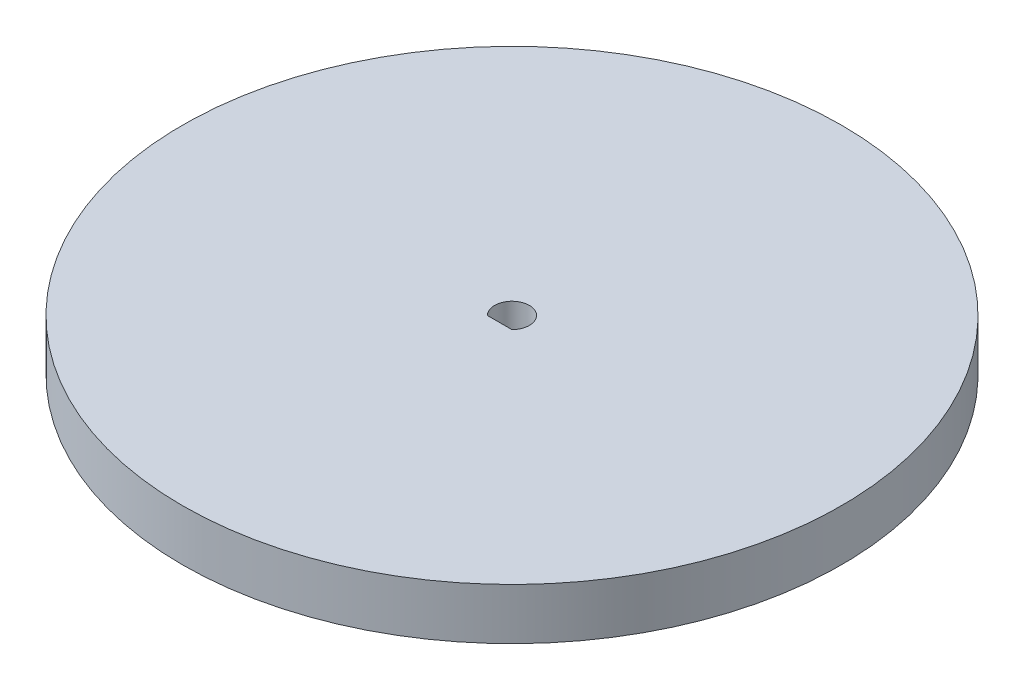
from build123d import *

# Parameters (mm, degrees)
SKETCH1_R           = 45
BOSS_EXTRUDE1_DEPTH = 7


with BuildPart() as part:
    # Sketch1 → Boss-Extrude1 (new body)
    with BuildSketch(Plane(origin=(0, 0, 0), x_dir=(1, 0, 0), z_dir=(0, 1, 0))):
        with Locations((-14.183277614, -0.508507062)):
            Circle(SKETCH1_R)
        with BuildLine():
            Line((-15.852777614, -2.197706502), (-12.513777614, -2.197706502))
            ThreePointArc((-12.513777614, -2.197706502), (-14.183277614, 1.866492938), (-15.852777614, -2.197706502))
        make_face(mode=Mode.SUBTRACT)
    extrude(amount=BOSS_EXTRUDE1_DEPTH)


solid = part.part
